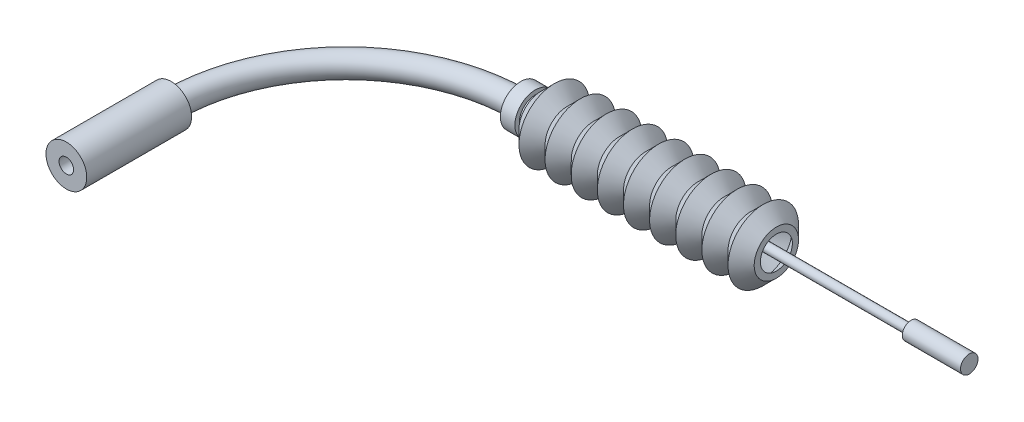
from build123d import *

# Parameters (mm, degrees)
SCHIZZO2_R        = 2
SCHIZZO2_R_2      = 1.25
SCHIZZO3_R        = 3.5
SCHIZZO3_R_2      = 1.25
ESTRUSIONE1_DEPTH = 18
SCHIZZO4_R        = 3.5
SCHIZZO4_R_2      = 1.25
ESTRUSIONE2_DEPTH = 2.5
SCHIZZO5_R        = 2.75
SCHIZZO5_R_2      = 1.25
ESTRUSIONE3_DEPTH = 4.5
SCHIZZO8_R        = 0.75
ESTRUSIONE4_DEPTH = 70
SCHIZZO9_R        = 1.5
ESTRUSIONE5_DEPTH = 10


with BuildPart() as part:
    # Sweep1: sweep along a path in Schizzo1
    with BuildLine(Plane(origin=(0, 0, 0), x_dir=(1, 0, 0), z_dir=(0, 1, 0))) as sweep1_path:
        ThreePointArc((0, 30), (-21.213203436, 21.213203436), (-30, 0))
    # Schizzo2 → Sweep1 (sweep)
    with BuildSketch(Plane.XY):
        with Locations((-30, 0)):
            Circle(SCHIZZO2_R)
        with Locations((-30, 0)):
            Circle(SCHIZZO2_R_2, mode=Mode.SUBTRACT)
    sweep(path=sweep1_path.line)

    # Schizzo3 → Estrusione1 (add)
    with BuildSketch(Plane.XY):
        with Locations((-30, 0)):
            Circle(SCHIZZO3_R)
        with Locations((-30, 0)):
            Circle(SCHIZZO3_R_2, mode=Mode.SUBTRACT)
    extrude(amount=ESTRUSIONE1_DEPTH)

    # Schizzo4 → Estrusione2 (add)
    with BuildSketch(Plane(origin=(0, 0, 0), x_dir=(0, 0, -1), z_dir=(1, 0, 0))):
        with Locations((30, 0)):
            Circle(SCHIZZO4_R)
        with Locations((30, 0)):
            Circle(SCHIZZO4_R_2, mode=Mode.SUBTRACT)
    extrude(amount=ESTRUSIONE2_DEPTH)

    # Schizzo5 → Estrusione3 (add)
    with BuildSketch(Plane(origin=(2.5, 0, 0), x_dir=(0, 0, -1), z_dir=(1, 0, 0))):
        with Locations((30, 0)):
            Circle(SCHIZZO5_R)
        with Locations((30, 0)):
            Circle(SCHIZZO5_R_2, mode=Mode.SUBTRACT)
    extrude(amount=ESTRUSIONE3_DEPTH)


with BuildPart() as body_2:
    # Schizzo7 → Rivoluzione1 (revolve)
    with BuildSketch(Plane.XY.offset(-30)):
        Polygon((3.5, 2.75), (5.75, 4.99271539), (8, 2.75), (10.235454364, 4.99271539), (12.485454364, 2.75), (14.720908728, 4.99271539), (16.970908728, 2.75), (19.206363092, 4.99271539), (21.456363092, 2.75), (23.691817456, 4.99271539), (25.943537237, 2.748285787), (28.178991601, 4.991001177), (30.428991601, 2.748285787), (32.664445965, 4.991001177), (34.914445965, 2.748285787), (37.149900329, 4.991001177), (39.40162011, 2.746571574), (41.637074474, 4.989286964), (43.887074474, 2.746571574), (43.887074474, 3.805516139), (41.635354694, 6.049945741), (39.399900329, 3.807230352), (37.148180549, 6.051659954), (34.912726185, 3.808944565), (32.662726185, 6.051659954), (30.42727182, 3.808944565), (28.17727182, 6.051659954), (25.941817456, 3.808944565), (23.690097676, 6.053374167), (21.454643311, 3.810658778), (19.204643311, 6.053374167), (16.969188947, 3.810658778), (14.719188947, 6.053374167), (12.483734583, 3.810658778), (10.233734583, 6.053374167), (7.998280219, 3.810658778), (5.75, 6.051659954), (3.5, 3.808944565), align=None)
    revolve(axis=Axis((7, 0, -30), (-1, 0, 0)))


with BuildPart() as body_3:
    # Schizzo8 → Estrusione4 (new body)
    with BuildSketch(Plane(origin=(7, 0, 0), x_dir=(0, 0, -1), z_dir=(1, 0, 0))):
        with Locations((30, 0)):
            Circle(SCHIZZO8_R)
    extrude(amount=ESTRUSIONE4_DEPTH)

    # Schizzo9 → Estrusione5 (add)
    with BuildSketch(Plane(origin=(77, 0, 0), x_dir=(0, 0, -1), z_dir=(1, 0, 0))):
        with Locations((30, 0)):
            Circle(SCHIZZO9_R)
    extrude(amount=-ESTRUSIONE5_DEPTH)


solid = Compound([part.part, body_2.part, body_3.part])
